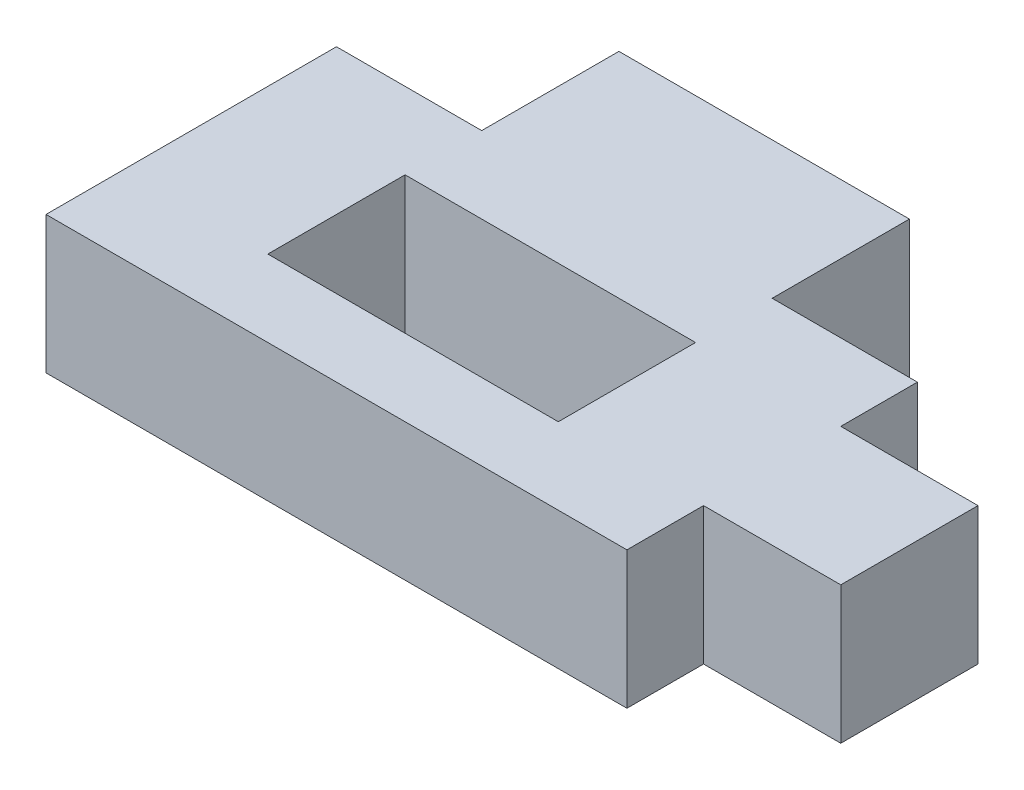
from build123d import *

# Parameters (mm, degrees)
SKETCH1_W           = 6.35
SKETCH1_H           = 3
BOSS_EXTRUDE1_DEPTH = 1.5


with BuildPart() as part:
    # Sketch1 → Boss-Extrude1 (new, symmetric)
    with BuildSketch(Plane(origin=(0, 0, 0), x_dir=(1, 0, 0), z_dir=(0, 1, 0))):
        Polygon((3.175, 3.175), (6.35, 3.175), (6.35, 1.5), (9.35, 1.5), (9.35, -1.5), (6.35, -1.5), (6.35, -3.175), (-6.35, -3.175), (-6.35, 3.175), (-3.175, 3.175), (-3.175, 6.175), (3.175, 6.175), align=None)
        Rectangle(SKETCH1_W, SKETCH1_H, mode=Mode.SUBTRACT)
    extrude(amount=BOSS_EXTRUDE1_DEPTH, both=True)


solid = part.part
